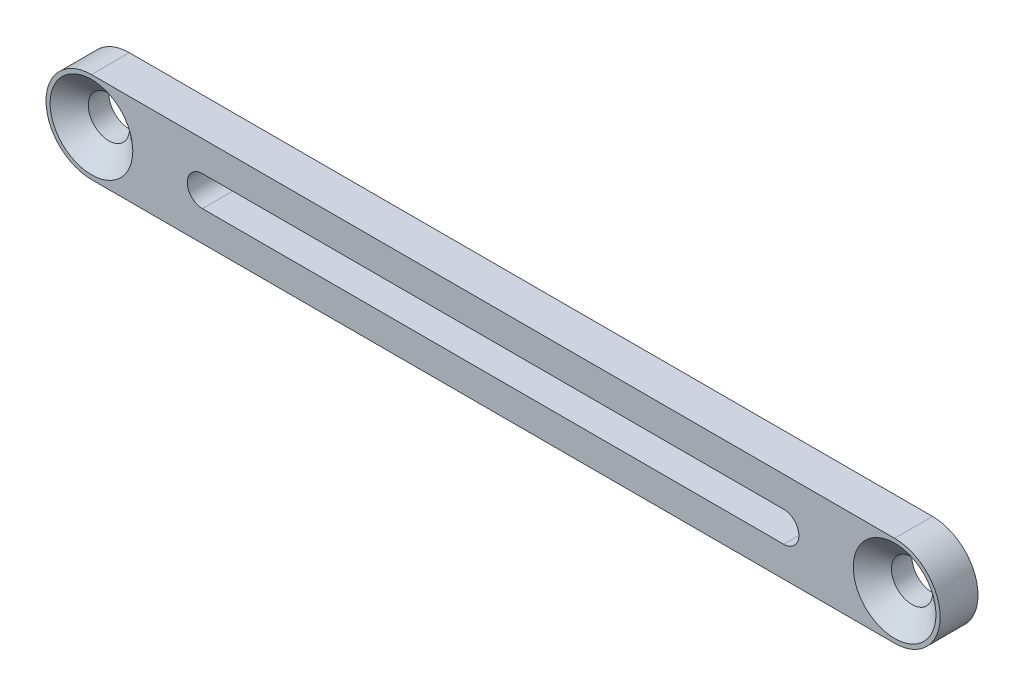
from build123d import *

# Parameters (mm, degrees)
BOSS_EXTRUDE1_DEPTH                               = 3.175
CSK_FOR_4_FLAT_HEAD_MACHINE_SCREW_100_D           = 3.4544
CSK_FOR_4_FLAT_HEAD_MACHINE_SCREW_100_CSINK_D     = 6.925818
CSK_FOR_4_FLAT_HEAD_MACHINE_SCREW_100_CSINK_ANGLE = 100
CUT_EXTRUDE1_DEPTH                                = 81.381515719


with BuildPart() as part:
    # Sketch1 → Boss-Extrude1 (new body)
    with BuildSketch(Plane.XY):
        with BuildLine():
            Line((5.469571116, 16.602717302), (72.76915781, 16.602717302))
            ThreePointArc((72.76915781, 16.602717302), (76.57915781, 20.412717302), (72.76915781, 24.222717302))
            Line((72.76915781, 24.222717302), (5.469571116, 24.222717302))
            ThreePointArc((5.469571116, 24.222717302), (1.659571116, 20.412717302), (5.469571116, 16.602717302))
        make_face()
    extrude(amount=BOSS_EXTRUDE1_DEPTH)

    # CSK for #4 Flat Head Machine Screw (100)1 (through all)
    with Locations(Plane.XY.offset(3.175)):
        with Locations((5.469571116, 20.412717302), (72.76915781, 20.412717302)):
            CounterSinkHole(CSK_FOR_4_FLAT_HEAD_MACHINE_SCREW_100_D / 2, CSK_FOR_4_FLAT_HEAD_MACHINE_SCREW_100_CSINK_D / 2, counter_sink_angle=CSK_FOR_4_FLAT_HEAD_MACHINE_SCREW_100_CSINK_ANGLE)

    # Sketch4 → Cut-Extrude1 (cut, through all)
    with BuildSketch(Plane(origin=(0, 0, 0), x_dir=(-1, 0, 0), z_dir=(0, 0, -1))):
        with BuildLine():
            Line((-63.47275781, 21.682717302), (-14.765971116, 21.682717302))
            ThreePointArc((-14.765971116, 21.682717302), (-13.495971116, 20.412717302), (-14.765971116, 19.142717302))
            Line((-14.765971116, 19.142717302), (-63.47275781, 19.142717302))
            ThreePointArc((-63.47275781, 19.142717302), (-64.74275781, 20.412717302), (-63.47275781, 21.682717302))
        make_face()
    extrude(amount=-CUT_EXTRUDE1_DEPTH, mode=Mode.SUBTRACT)


solid = part.part
